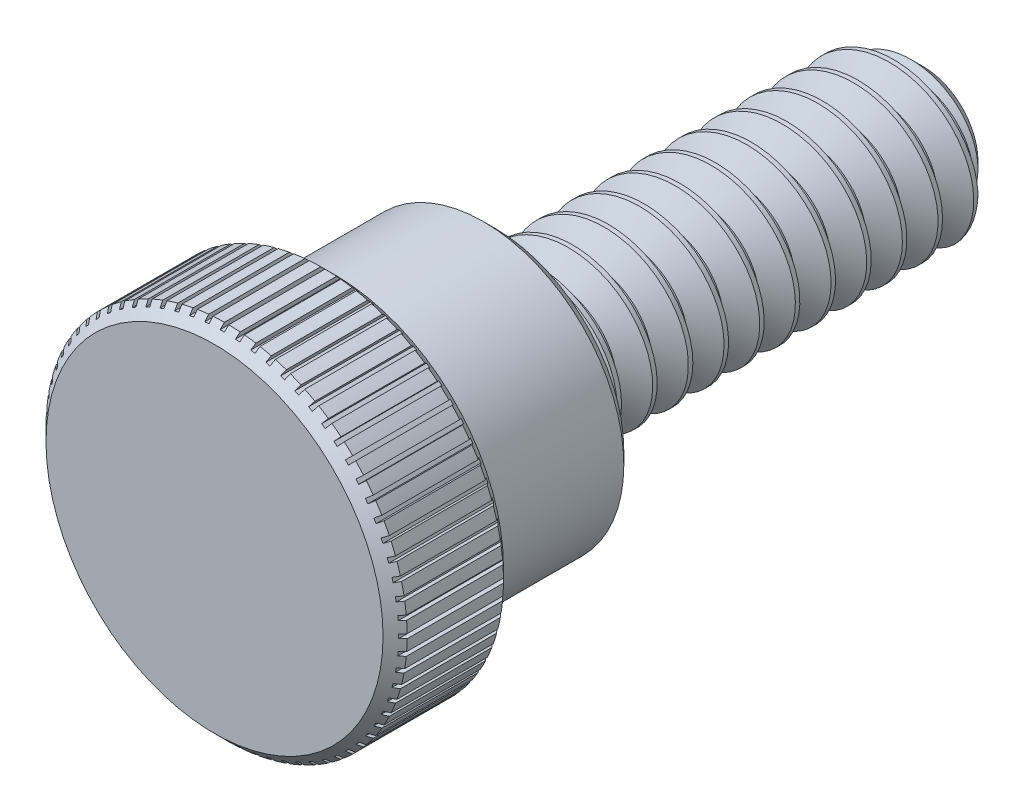
from build123d import *

# Parameters (mm, degrees)
SKETCH1_R               = 2.413
EXTRUDE1_DEPTH          = 12.7
CHAMFER2_SIZE           = 0.79375
CUT_SWEEP1_PITCH        = 1.058333333
SKETCH27_R              = 4.1671875
BOSS_EXTRUDE4_DEPTH     = 4.7625
SKETCH21_R              = 5.3578125
BOSS_EXTRUDE1_DEPTH     = 3.571875
CHAMFER3_SIZE           = 0.3571875
FILLET1_R               = 0.3571875
CUT_EXTRUDE1_REACH      = 19.459
CUT_EXTRUDE1_END_RADIUS = 5.3578125
SKETCH22_W              = 0.127
SKETCH22_H              = 3.571875
CIRPATTERN1_COUNT       = 72


with BuildPart() as part:
    # Sketch1 → Extrude1 (new body)
    with BuildSketch(Plane.XY):
        Circle(SKETCH1_R)
    extrude(amount=-EXTRUDE1_DEPTH)

    # Chamfer2
    chamfer2_edges = [part.edges().sort_by_distance(p)[0] for p in [
        (-2.413, 0, -12.7),
    ]]
    chamfer(chamfer2_edges, length=CHAMFER2_SIZE)

    # Cut-Sweep1: the profile of Sketch14 profile screwed along a right-hand helix of 13 turns, 8 arcs to a turn; built about Z, then put on its axis
    cut_sweep1_z = Axis((0, 0, 0), (0, 0, 1))
    cut_sweep1_corners = [(2.4133, 0, 0.000173205), (2.4133, 0, -0.926214872), (1.725592336, 0, -0.529166667), (1.725592336, 0, -0.396875)]
    with BuildLine(mode=Mode.PRIVATE) as cut_sweep1_profile:
        Line(cut_sweep1_corners[0], cut_sweep1_corners[1])
        Line(cut_sweep1_corners[1], cut_sweep1_corners[2])
        Line(cut_sweep1_corners[2], cut_sweep1_corners[3])
        Line(cut_sweep1_corners[3], cut_sweep1_corners[0])
    cut_sweep1_cap = Face(cut_sweep1_profile.wire())
    cut_sweep1_turn_angles = [0, 22.5, 45, 67.5, 90, 112.5, 135, 157.5, 180, 202.5, 225, 247.5, 270, 292.5, 315, 337.5, 360]
    cut_sweep1_turn_weights = [1, 0.9238795325112867, 1, 0.9238795325112867, 1, 0.9238795325112867, 1, 0.9238795325112867, 1, 0.9238795325112867, 1, 0.9238795325112867, 1, 0.9238795325112867, 1, 0.9238795325112867, 1]
    cut_sweep1_turn_rails = [Edge.make_bspline([Vector(p[0], p[1], 0).rotate(cut_sweep1_z, cut_sweep1_turn_angles[k]) / cut_sweep1_turn_weights[k] + Vector(0, 0, p[2] + CUT_SWEEP1_PITCH * cut_sweep1_turn_angles[k] / 360) for k in range(17)], [0, 0, 0, 1, 1, 2, 2, 3, 3, 4, 4, 5, 5, 6, 6, 7, 7, 8, 8, 8], 2, cut_sweep1_turn_weights) for p in cut_sweep1_corners]
    cut_sweep1_turn_sides = [Face.make_surface_from_curves(cut_sweep1_turn_rails[p[0]], cut_sweep1_turn_rails[p[1]]) for p in [(0, 1), (1, 2), (2, 3), (3, 0)]]
    cut_sweep1 = Plane(origin=(0, 0, -12.7), x_dir=(0, 1, 0), z_dir=(0, 0, 1)) * Solid(Shell([*[p.moved(Location((0, 0, CUT_SWEEP1_PITCH * i))) for i in range(13) for p in cut_sweep1_turn_sides], cut_sweep1_cap, cut_sweep1_cap.rotate(cut_sweep1_z, 4680).moved(Location((0, 0, CUT_SWEEP1_PITCH * 4680 / 360)))]))
    add(cut_sweep1, mode=Mode.SUBTRACT)

    # Sketch27 → Boss-Extrude4 (add)
    with BuildSketch(Plane.XY):
        with Locations(Location((0, 0, 0), (0, 0, 180))):
            Circle(SKETCH27_R)
    extrude(amount=BOSS_EXTRUDE4_DEPTH)

    # Sketch21 → Boss-Extrude1 (add)
    with BuildSketch(Plane.XY.offset(4.7625)):
        with Locations(Location((0, 0, 0), (0, 0, 180))):
            Circle(SKETCH21_R)
    extrude(amount=BOSS_EXTRUDE1_DEPTH)

    # Chamfer3
    chamfer3_edges = [part.edges().sort_by_distance(p)[0] for p in [
        (4.1671875, 0, 0),
        (5.3578125, 0, 4.7625),
        (5.3578125, 0, 8.334375),
    ]]
    chamfer(chamfer3_edges, length=CHAMFER3_SIZE)

    # Fillet1
    fillet1_edges = [part.edges().sort_by_distance(p)[0] for p in [
        (4.1671875, 0, 4.7625),
    ]]
    fillet(fillet1_edges, radius=FILLET1_R)

    # Cut-Extrude1: up to this cylinder (the profile starts outside it)
    cut_extrude1_end = Plane(origin=(0, -0.127, 6.548437), z_dir=(0, 0, -1)) * Cylinder(CUT_EXTRUDE1_END_RADIUS, 50.633625, mode=Mode.PRIVATE)
    # Sketch22 → Cut-Extrude1 (cut, up to the surface)
    with BuildSketch(Plane(origin=(0, 5.3578125, 0), x_dir=(-1, 0, 0), z_dir=(0, 1, 0)), mode=Mode.PRIVATE) as cut_extrude1_sk1:
        with Locations((0, 6.5484375)):
            Rectangle(SKETCH22_W, SKETCH22_H)
    cut_extrude1_tool1 = extrude(cut_extrude1_sk1.sketch, amount=-CUT_EXTRUDE1_REACH, mode=Mode.PRIVATE) - cut_extrude1_end
    cut_extrude1 = cut_extrude1_tool1.solids().sort_by_distance((0, 5.357812, 6.548437))[0]
    add(cut_extrude1, mode=Mode.SUBTRACT)

    # CirPattern1: Cut-Extrude1 ×72 about axis
    cirpattern1_axis = Axis((0, 0, 0), (0, 0, 1))
    for i in range(1, CIRPATTERN1_COUNT):
        add(cut_extrude1.rotate(cirpattern1_axis, i * 360 / CIRPATTERN1_COUNT), mode=Mode.SUBTRACT)


solid = part.part
